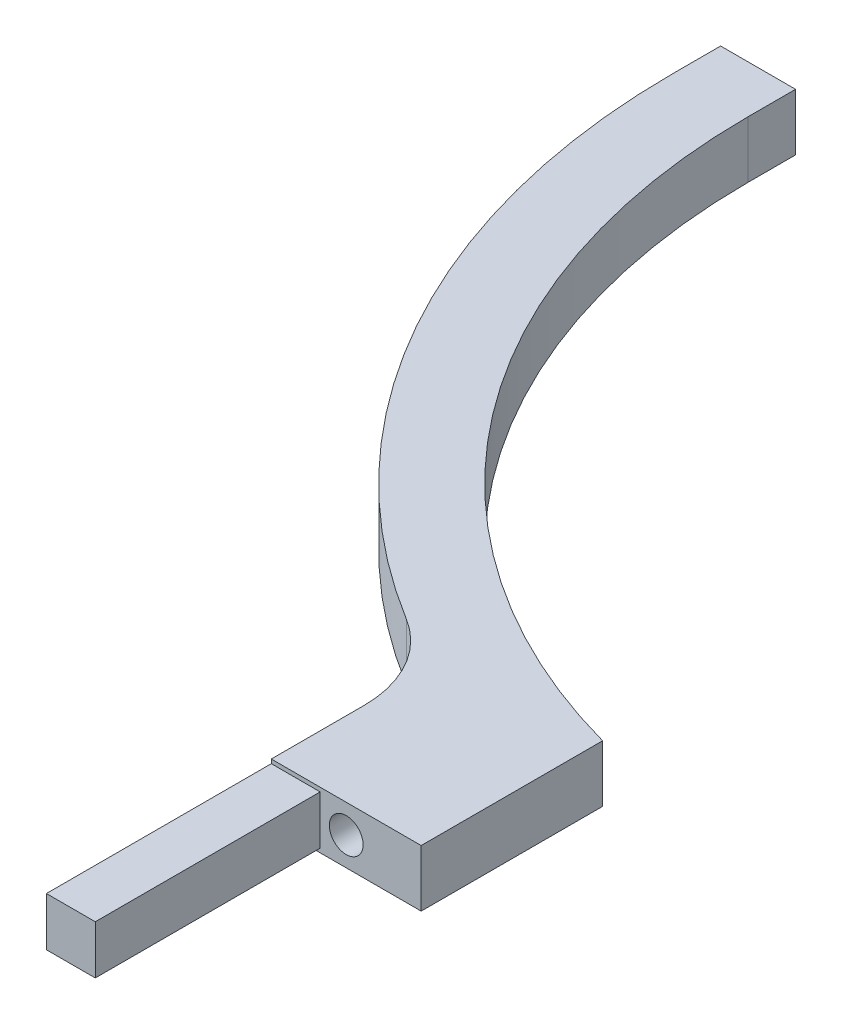
from build123d import *

# Parameters (mm, degrees)
BOSS_EXTRUDE1_DEPTH = 15.16426412
SKETCH5_R           = 4.505
CUT_EXTRUDE1_DEPTH  = 30
SKETCH6_W           = 20
SKETCH6_H           = 15.16426412
BOSS_EXTRUDE2_DEPTH = 12.7
FILLET1_R           = 30
SKETCH7_W           = 13.04
SKETCH7_H           = 13
BOSS_EXTRUDE3_DEPTH = 60
SKETCH8_R           = 1.5
CUT_EXTRUDE2_DEPTH  = 10


with BuildPart() as part:
    # Sketch4 → Boss-Extrude1 (new body)
    with BuildSketch(Plane(origin=(0, 0, 0), x_dir=(1, 0, 0), z_dir=(0, 1, 0))):
        with BuildLine():
            Line((-189.6, 0), (-169.6, 0))
            ThreePointArc((-169.6, 0), (-134.84194303, -102.867926974), (-44.8145, -163.572065432))
            Line((-44.8145, -163.572065432), (-44.8145, -211.979244013))
            Line((-44.8145, -211.979244013), (-84.8, -211.979244013))
            Line((-84.8, -211.979244013), (-84.8, -169.579244013))
            ThreePointArc((-84.8, -169.579244013), (-161.285833228, -99.674670805), (-189.6, 0))
        make_face()
    extrude(amount=-BOSS_EXTRUDE1_DEPTH)

    # Sketch5 → Cut-Extrude1 (cut)
    with BuildSketch(Plane.XY.offset(211.979244013)):
        with Locations((-64.80725, -7.58213206)):
            Circle(SKETCH5_R)
    extrude(amount=-CUT_EXTRUDE1_DEPTH, mode=Mode.SUBTRACT)

    # Sketch6 → Boss-Extrude2 (add)
    with BuildSketch(Plane(origin=(0, 0, 0), x_dir=(-1, 0, 0), z_dir=(0, 0, -1))):
        with Locations((179.6, -7.58213206)):
            Rectangle(SKETCH6_W, SKETCH6_H)
    extrude(amount=BOSS_EXTRUDE2_DEPTH)

    # Fillet1
    fillet1_edges = [part.edges().sort_by_distance(p)[0] for p in [
        (-84.8, -7.58213206, 169.579244013),
    ]]
    fillet(fillet1_edges, radius=FILLET1_R)

    # Sketch7 → Boss-Extrude3 (add)
    with BuildSketch(Plane.XY.offset(211.979244013)):
        with Locations((-78.28, -7.58213206)):
            Rectangle(SKETCH7_W, SKETCH7_H)
    extrude(amount=BOSS_EXTRUDE3_DEPTH)

    # Sketch8 → Cut-Extrude2 (cut)
    with BuildSketch(Plane.ZY.offset(84.8)):
        with Locations((231.979244013, -7.58213206)):
            Circle(SKETCH8_R)
        with Locations((251.979244013, -7.58213206)):
            Circle(SKETCH8_R)
    extrude(amount=-CUT_EXTRUDE2_DEPTH, mode=Mode.SUBTRACT)


solid = part.part
